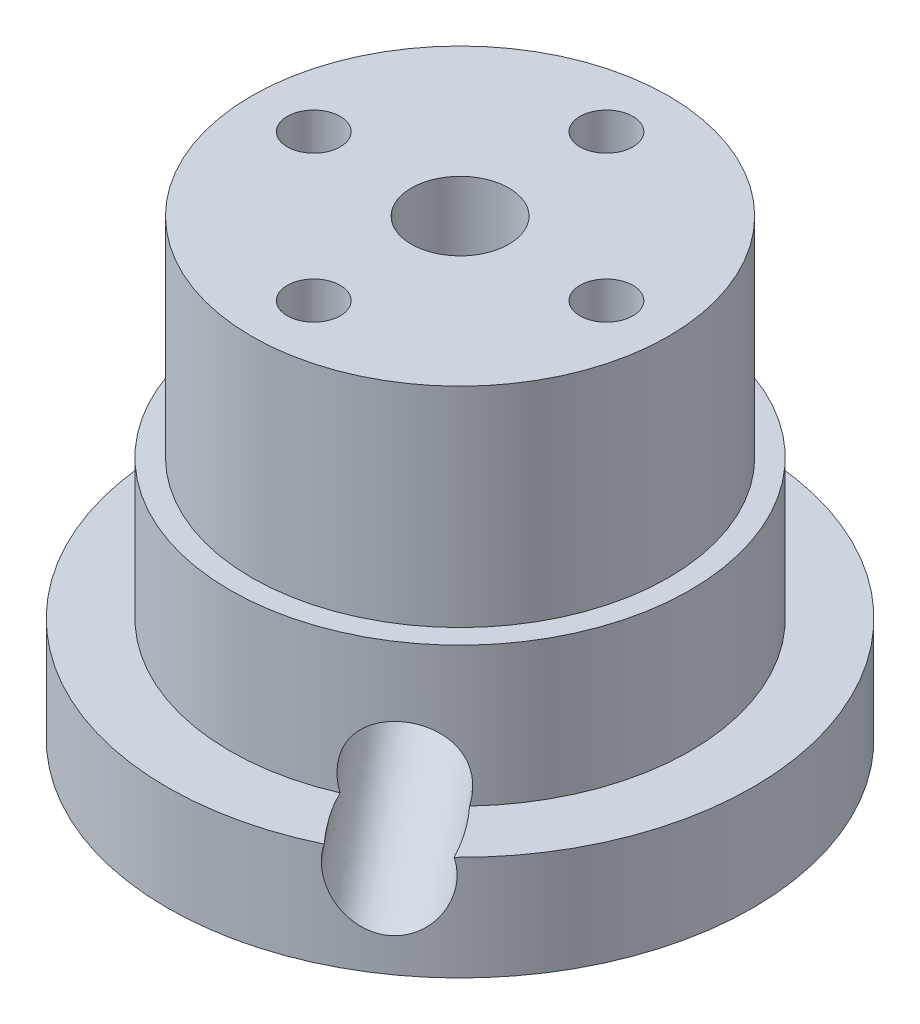
from build123d import *

# Parameters (mm, degrees)
CROQUIS1_R                   = 21
SALIENTE_EXTRUIR1_DEPTH      = 7.5
CROQUIS2_R                   = 14.95
SALIENTE_EXTRUIR2_DEPTH      = 25
CORTAR_EXTRUIR1_DEPTH        = 45.025560757
CORTAR_EXTRUIR1_DEPTH_BACK   = 2.5
CORTAR_EXTRUIR2_DEPTH        = 43.213741838
CORTAR_EXTRUIR2_DEPTH_BACK   = 1.5
CROQUIS4_R                   = 5.5
CROQUIS7_R                   = 16.5
SALIENTE_EXTRUIR3_DEPTH      = 10
AGUJEROS_INJERTOS_DEPTH      = 45.025560757
AGUJEROS_INJERTOS_DEPTH_BACK = 5.5
CROQUIS6_R                   = 1.9
CORTAR_BARRER2_PROFILE_R     = 3.5
CORTAR_EXTRUIR3_DEPTH        = 45.025560927
CORTAR_EXTRUIR3_DEPTH_BACK   = 45.025560927
CROQUIS27_R                  = 3.5


with BuildPart() as part:
    # Croquis1 → Saliente-Extruir1 (new body)
    with BuildSketch(Plane(origin=(0, 0, 0), x_dir=(1, 0, 0), z_dir=(0, 1, 0))):
        Circle(CROQUIS1_R)
    extrude(amount=SALIENTE_EXTRUIR1_DEPTH)

    # Croquis2 → Saliente-Extruir2 (add)
    with BuildSketch(Plane(origin=(0, 7.5, 0), x_dir=(1, 0, 0), z_dir=(0, 1, 0))):
        Circle(CROQUIS2_R)
    extrude(amount=SALIENTE_EXTRUIR2_DEPTH)

    # Croquis3 → Cortar-Extruir1 (cut, two sides: drawn at the far end of the back side and taken through both)
    with BuildSketch(Plane.XZ.offset(-CORTAR_EXTRUIR1_DEPTH_BACK)):
        with BuildLine():
            Line((4.2, -5.5), (4.2, -8.435240551))
            Line((4.2, -8.435240551), (2.665416399, -17.930761444))
            ThreePointArc((2.665416399, -17.930761444), (0, -20.2), (-2.665416398, -17.930761445))
            Line((-2.665416398, -17.930761445), (-4.2, -8.435240551))
            Line((-4.2, -8.435240551), (-4.2, -5.5))
            ThreePointArc((-4.2, -5.5), (-4.580761184, -4.580761185), (-5.5, -4.2))
            Line((-5.5, -4.2), (-8.435240551, -4.2))
            Line((-8.435240551, -4.2), (-17.930761444, -2.665416399))
            ThreePointArc((-17.930761444, -2.665416399), (-20.2, 0), (-17.930761445, 2.665416398))
            Line((-17.930761445, 2.665416398), (-8.435240551, 4.2))
            Line((-8.435240551, 4.2), (-5.5, 4.2))
            ThreePointArc((-5.5, 4.2), (-4.580761185, 4.580761184), (-4.2, 5.5))
            Line((-4.2, 5.5), (-4.2, 8.435240551))
            Line((-4.2, 8.435240551), (-2.665416399, 17.930761444))
            ThreePointArc((-2.665416399, 17.930761444), (0, 20.2), (2.665416398, 17.930761445))
            Line((2.665416398, 17.930761445), (4.2, 8.435240551))
            Line((4.2, 8.435240551), (4.2, 5.5))
            ThreePointArc((4.2, 5.5), (4.580761184, 4.580761185), (5.5, 4.2))
            Line((5.5, 4.2), (8.435240551, 4.2))
            Line((8.435240551, 4.2), (17.930761444, 2.665416399))
            ThreePointArc((17.930761444, 2.665416399), (20.2, 0), (17.930761445, -2.665416398))
            Line((17.930761445, -2.665416398), (8.435240551, -4.2))
            Line((8.435240551, -4.2), (5.5, -4.2))
            ThreePointArc((5.5, -4.2), (4.580761185, -4.580761184), (4.2, -5.5))
        make_face()
    extrude(amount=CORTAR_EXTRUIR1_DEPTH + CORTAR_EXTRUIR1_DEPTH_BACK, mode=Mode.SUBTRACT)

    # Croquis4 → Cortar-Extruir2 (cut, two sides: drawn at the far end of the back side and taken through both)
    with BuildSketch(Plane.XZ.offset(-2.5).offset(-CORTAR_EXTRUIR2_DEPTH_BACK)):
        Circle(CROQUIS4_R)
    extrude(amount=CORTAR_EXTRUIR2_DEPTH + CORTAR_EXTRUIR2_DEPTH_BACK, mode=Mode.SUBTRACT)

    # Croquis7 → Saliente-Extruir3 (add)
    with BuildSketch(Plane(origin=(0, 7.5, 0), x_dir=(1, 0, 0), z_dir=(0, 1, 0))):
        Circle(CROQUIS7_R)
    extrude(amount=SALIENTE_EXTRUIR3_DEPTH)

    # Croquis6 → Agujeros Injertos (cut, two sides: drawn at the far end of the back side and taken through both)
    with BuildSketch(Plane(origin=(0, 32.5, 0), x_dir=(1, 0, 0), z_dir=(0, 1, 0)).offset(-AGUJEROS_INJERTOS_DEPTH_BACK)):
        with Locations((0, 10.5)):
            Circle(CROQUIS6_R)
        with Locations((10.5, 0)):
            Circle(CROQUIS6_R)
        with Locations((0, -10.5)):
            Circle(CROQUIS6_R)
        with Locations((-10.5, 0)):
            Circle(CROQUIS6_R)
    extrude(amount=AGUJEROS_INJERTOS_DEPTH + AGUJEROS_INJERTOS_DEPTH_BACK, mode=Mode.SUBTRACT)

    # Cortar-Barrer2: sweep along a path in Croquis13
    with BuildLine() as cortar_barrer2_path:  # in the path sketch's own coordinates; laid on its plane below (add() does not lay a ready-made edge on the line's plane)
        add(Edge.make_bspline(
            [(-4.46673398, 25.209606654), (-10.549350572, 9.832711986), (-18.953647617, 0), (-32.5, 0)],
            knots=[0, 0, 0, 0, 1, 1, 1, 1], degree=3))
    # Cortar-Barrer2 profile (on start of the path) → Cortar-Barrer2 (sweep, cut)
    with BuildSketch(Plane(origin=(14.459636346, 4.46673398, 20.650500826), x_dir=(-0.8191520442889929, 0, 0.5735764363510444), z_dir=(-0.5333634711709478, 0.3678356093614, -0.7617219782218477))):
        Circle(CORTAR_BARRER2_PROFILE_R)
    sweep(path=Plane(origin=(0, 0, 0), x_dir=(0, -1, 0), z_dir=(-0.819152044288993, 0, 0.5735764363510444)) * cortar_barrer2_path.line, mode=Mode.SUBTRACT)

    # Croquis27 → Cortar-Extruir3 (cut, two sides: drawn at the far end of the back side and taken through both)
    with BuildSketch(Plane(origin=(0, 32.5, 0), x_dir=(1, 0, 0), z_dir=(0, 1, 0)).offset(-CORTAR_EXTRUIR3_DEPTH_BACK)):
        Circle(CROQUIS27_R)
    extrude(amount=CORTAR_EXTRUIR3_DEPTH + CORTAR_EXTRUIR3_DEPTH_BACK, mode=Mode.SUBTRACT)


solid = part.part
